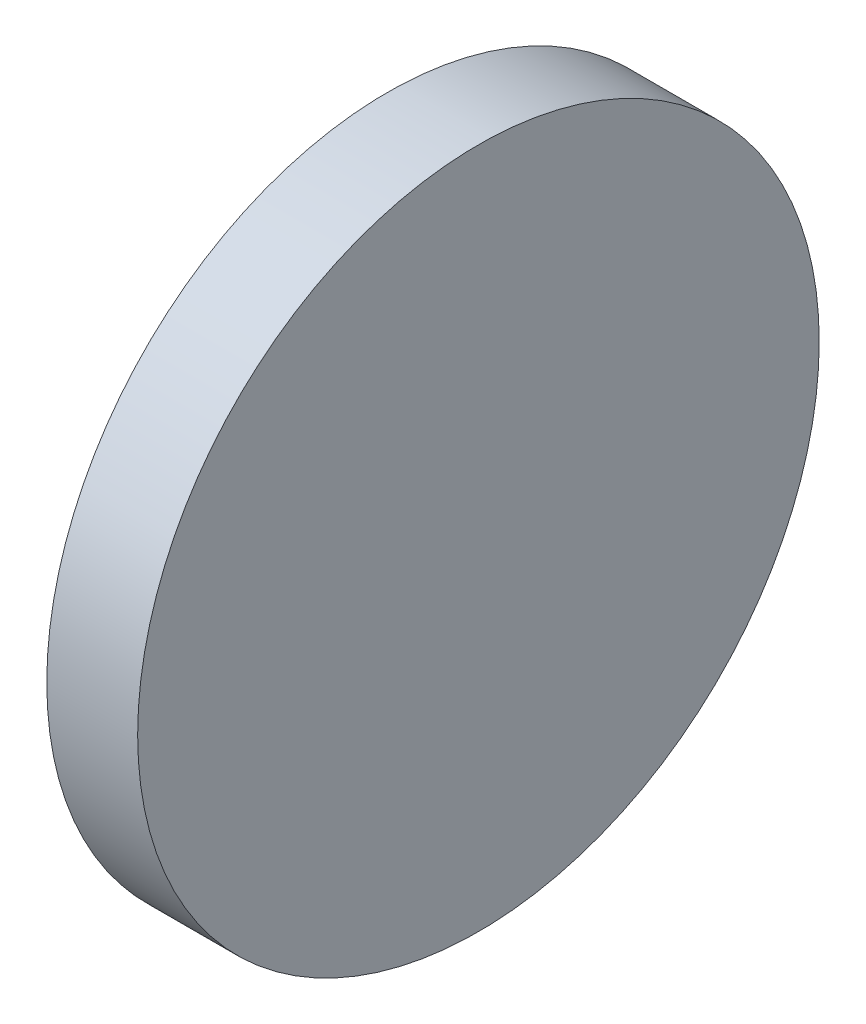
from build123d import *

# Parameters (mm, degrees)
SKETCH_1_R      = 75
EXTRUDE_1_DEPTH = 20


with BuildPart() as part:
    # Эскиз1 → Бобышка-Вытянуть1 (new body)
    with BuildSketch(Plane(origin=(0, 0, 0), x_dir=(0, 0, -1), z_dir=(1, 0, 0))):
        Circle(SKETCH_1_R)
    extrude(amount=EXTRUDE_1_DEPTH)


solid = part.part
